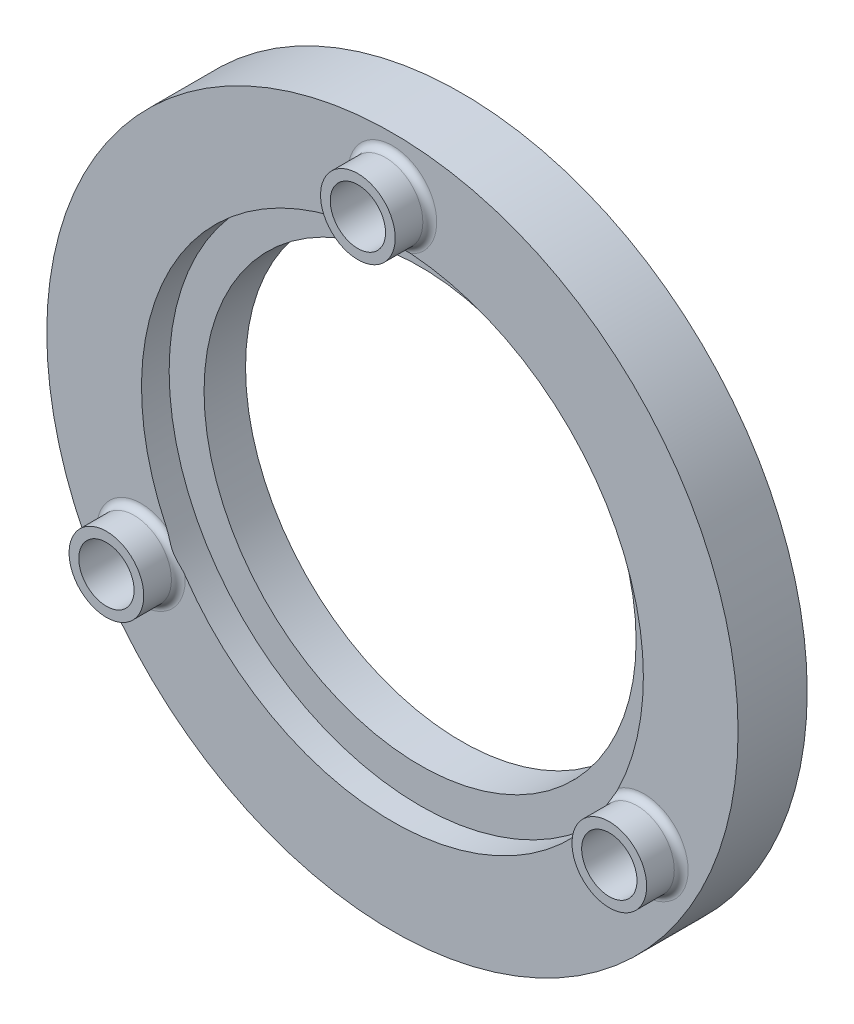
from build123d import *

# Parameters (mm, degrees)
SKETCH1_R           = 25
SKETCH1_R_2         = 15.625
BOSS_EXTRUDE1_DEPTH = 5
SKETCH2_R           = 18.15
CUT_EXTRUDE1_DEPTH  = 2
SKETCH3_R           = 2
CUT_EXTRUDE2_DEPTH  = 5
CUT_EXTRUDE3_DEPTH  = 2.7
BOSS_EXTRUDE2_START = 2.5
SKETCH5_R           = 2.7
SKETCH5_R_2         = 2
BOSS_EXTRUDE2_DEPTH = 2.5
FILLET1_R           = 0.5
FILLET2_R           = 0.5
FILLET3_R           = 0.5


with BuildPart() as part:
    # Sketch1 → Boss-Extrude1 (new body)
    with BuildSketch(Plane.XY):
        Circle(SKETCH1_R)
        Circle(SKETCH1_R_2, mode=Mode.SUBTRACT)
    extrude(amount=BOSS_EXTRUDE1_DEPTH)

    # Sketch2 → Cut-Extrude1 (cut)
    with BuildSketch(Plane.XY.offset(5)):
        Circle(SKETCH2_R)
    extrude(amount=-CUT_EXTRUDE1_DEPTH, mode=Mode.SUBTRACT)

    # Sketch3 → Cut-Extrude2 (cut)
    with BuildSketch(Plane.XY.offset(5)):
        with Locations((0, 21)):
            Circle(SKETCH3_R)
        with Locations((-18.186533479, -10.5)):
            Circle(SKETCH3_R)
        with Locations((18.186533479, -10.5)):
            Circle(SKETCH3_R)
    extrude(amount=-CUT_EXTRUDE2_DEPTH, mode=Mode.SUBTRACT)

    # Sketch4 → Cut-Extrude3 (cut)
    with BuildSketch(Plane(origin=(0, 0, 0), x_dir=(-1, 0, 0), z_dir=(0, 0, -1))):
        Polygon((3.464101615, 21), (1.732050808, 24), (-1.732050808, 24), (-3.464101615, 21), (-1.732050808, 18), (1.732050808, 18), align=None)
        Polygon((-16.454482672, -13.5), (-19.918584287, -13.5), (-21.650635095, -10.5), (-19.918584287, -7.5), (-16.454482672, -7.5), (-14.722431864, -10.5), align=None)
        Polygon((19.918584287, -13.5), (21.650635095, -10.5), (19.918584287, -7.5), (16.454482672, -7.5), (14.722431864, -10.5), (16.454482672, -13.5), align=None)
    extrude(amount=-CUT_EXTRUDE3_DEPTH, mode=Mode.SUBTRACT)

    # Sketch5 → Boss-Extrude2 (add)
    # profile 1 of 3: a face of its own
    with BuildSketch(Plane.XY.offset(5).offset(BOSS_EXTRUDE2_START)):
        with Locations((0, 21)):
            Circle(SKETCH5_R)
        with Locations((0, 21)):
            Circle(SKETCH5_R_2, mode=Mode.SUBTRACT)
    # profile 2 of 3: a face of its own
    with BuildSketch(Plane.XY.offset(5).offset(BOSS_EXTRUDE2_START)):
        with Locations((-18.186533479, -10.5)):
            Circle(SKETCH5_R)
        with Locations((-18.186533479, -10.5)):
            Circle(SKETCH5_R_2, mode=Mode.SUBTRACT)
    # profile 3 of 3: a face of its own
    with BuildSketch(Plane.XY.offset(5).offset(BOSS_EXTRUDE2_START)):
        with Locations((18.186533479, -10.5)):
            Circle(SKETCH5_R)
        with Locations((18.186533479, -10.5)):
            Circle(SKETCH5_R_2, mode=Mode.SUBTRACT)
    extrude(amount=-BOSS_EXTRUDE2_DEPTH)

    # Fillet1
    # the kernel refuses this fillet: 0.5 mm, written as the material it adds along each edge
    with BuildSketch(Plane(origin=(-18.186533479, -10.5, 5), x_dir=(1, 0, 0), z_dir=(0, -1, 0))) as fillet1_piece_1_section:
        with BuildLine():
            CenterArc((2.7 + FILLET1_R, FILLET1_R), FILLET1_R, 180, 90)
            Line((2.7, FILLET1_R), (2.7, 0))
            Line((2.7, 0), (2.7 + FILLET1_R, 0))
        make_face()
    fillet1_piece_1 = revolve(axis=Axis((-18.186533479, -10.5, 5), (0, 0, 1)), mode=Mode.PRIVATE)
    fillet1_piece_1 = fillet1_piece_1 - Plane(origin=(0, 0, 5.139143481), x_dir=(1, 0, 0), z_dir=(0, 0, 1)) * Cylinder(18.15, 13, mode=Mode.PRIVATE)
    add(fillet1_piece_1)

    # Fillet2
    # the kernel refuses this fillet: 0.5 mm, written as the material it adds along each edge
    with BuildSketch(Plane(origin=(18.186533479, -10.5, 5), x_dir=(1, 0, 0), z_dir=(0, -1, 0))) as fillet2_piece_1_section:
        with BuildLine():
            CenterArc((2.7 + FILLET2_R, FILLET2_R), FILLET2_R, 180, 90)
            Line((2.7, FILLET2_R), (2.7, 0))
            Line((2.7, 0), (2.7 + FILLET2_R, 0))
        make_face()
    fillet2_piece_1 = revolve(axis=Axis((18.186533479, -10.5, 5), (0, 0, 1)), mode=Mode.PRIVATE)
    fillet2_piece_1 = fillet2_piece_1 - Plane(origin=(0, 0, 5.139143483), x_dir=(1, 0, 0), z_dir=(0, 0, 1)) * Cylinder(18.15, 13, mode=Mode.PRIVATE)
    add(fillet2_piece_1)

    # Fillet3
    # the kernel refuses this fillet: 0.5 mm, written as the material it adds along each edge
    with BuildSketch(Plane(origin=(0, 21, 5), x_dir=(1, 0, 0), z_dir=(0, -1, 0))) as fillet3_piece_1_section:
        with BuildLine():
            CenterArc((2.7 + FILLET3_R, FILLET3_R), FILLET3_R, 180, 90)
            Line((2.7, FILLET3_R), (2.7, 0))
            Line((2.7, 0), (2.7 + FILLET3_R, 0))
        make_face()
    fillet3_piece_1 = revolve(axis=Axis((0, 21, 5), (0, 0, 1)), mode=Mode.PRIVATE)
    fillet3_piece_1 = fillet3_piece_1 - Plane(origin=(0, 0, 5.139143484), x_dir=(1, 0, 0), z_dir=(0, 0, 1)) * Cylinder(18.15, 13, mode=Mode.PRIVATE)
    add(fillet3_piece_1)


solid = part.part
